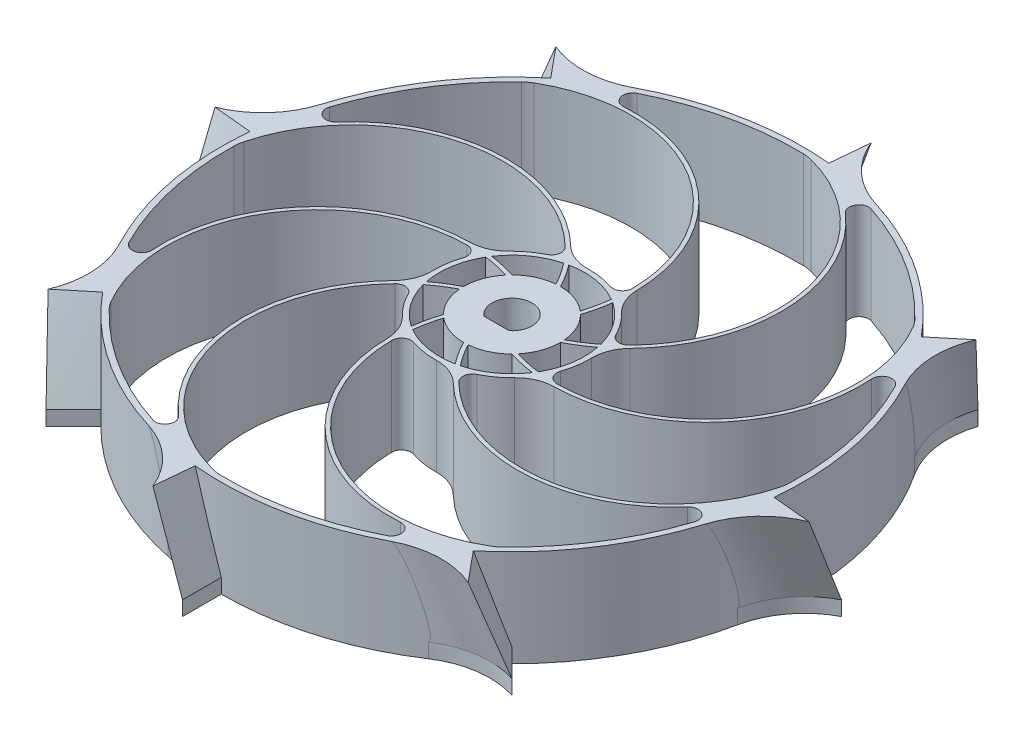
from build123d import *

# Parameters (mm, degrees)
SKETCH1_R             = 60
SKETCH1_R_2           = 58.8
BOSS_EXTRUDE1_DEPTH   = 20
SKETCH1_R_3           = 10
BOSS_EXTRUDE1_2_DEPTH = 20
BOSS_EXTRUDE4_DEPTH   = 20
CIRPATTERN1_COUNT     = 8
SKETCH2_R             = 16
SKETCH2_R_2           = 15
BOSS_EXTRUDE2_DEPTH   = 20
FILLET1_R             = 2
FILLET2_R             = 8
BOSS_EXTRUDE6_START   = -3
BOSS_EXTRUDE6_DEPTH   = 3
CIRPATTERN2_COUNT     = 8


with BuildPart() as part:
    # Sketch1 → Boss-Extrude1 (new body)
    with BuildSketch(Plane(origin=(0, 0, 0), x_dir=(1, 0, 0), z_dir=(0, 1, 0))):
        with Locations(Location((0, 0, 0), (0, 0, 270))):
            Circle(SKETCH1_R)
        with Locations(Location((0, 0, 0), (0, 0, 270))):
            Circle(SKETCH1_R_2, mode=Mode.SUBTRACT)
    extrude(amount=BOSS_EXTRUDE1_DEPTH)



with BuildPart() as body_2:
    # Sketch1 → Boss-Extrude1 2 (new body)
    with BuildSketch(Plane(origin=(0, 0, 0), x_dir=(1, 0, 0), z_dir=(0, 1, 0))):
        with Locations(Location((0, 0, 0), (0, 0, 270))):
            Circle(SKETCH1_R_3)
        with BuildLine():
            ThreePointArc((2.603003073, -3.2), (0, 4.125), (-2.603003073, -3.2))
            Line((-2.603003073, -3.2), (2.603003073, -3.2))
        make_face(mode=Mode.SUBTRACT)
    extrude(amount=BOSS_EXTRUDE1_2_DEPTH)


with BuildPart() as part_1:
    add(part.part)

    add(body_2.part)  # Boss-Extrude4 merges body 2
    # Sketch4 → Boss-Extrude4 (add)
    with BuildSketch(Plane(origin=(0, 0, 0), x_dir=(1, 0, 0), z_dir=(0, 1, 0))):
        with BuildLine():
            Line((-9.632475442, -0.71058124), (-10, 0))
            ThreePointArc((-10, 0), (-26.841730813, -33.640288469), (0, -60))
            Line((0, -60), (0.117199585, -59.208631402))
            ThreePointArc((0.117199585, -59.208631402), (-26.052615674, -33.508769279), (-9.632475442, -0.71058124))
        make_face()
    boss_extrude4 = extrude(amount=BOSS_EXTRUDE4_DEPTH)

    # CirPattern1: Boss-Extrude4 ×8 about axis
    cirpattern1_axis = Axis((0, 0, 0), (0, 1, 0))
    for i in range(1, CIRPATTERN1_COUNT):
        add(boss_extrude4.rotate(cirpattern1_axis, i * 360 / CIRPATTERN1_COUNT))

    # Sketch2 → Boss-Extrude2 (add)
    with BuildSketch(Plane(origin=(0, 0, 0), x_dir=(1, 0, 0), z_dir=(0, 1, 0))):
        Circle(SKETCH2_R)
        Circle(SKETCH2_R_2, mode=Mode.SUBTRACT)
    extrude(amount=BOSS_EXTRUDE2_DEPTH)

    # Fillet1
    fillet1_edges = [part_1.edges().sort_by_distance(p)[0] for p in [
        (-37.075909324, 10, -45.637889388),
        (-6.054234164, 10, 58.487487967),
        (6.054234164, 10, -58.487487967),
        (45.637889388, 10, -37.075909324),
        (58.487487967, 10, 6.054234164),
        (37.075909324, 10, 45.637889388),
        (-15.348469246, 10, 4.519346393),
        (-14.048667165, 10, -7.657346203),
        (-4.519346393, 10, -15.348469246),
        (7.657346203, 10, -14.048667165),
        (15.348469246, 10, -4.519346393),
        (14.048667165, 10, 7.657346203),
        (4.519346393, 10, 15.348469246),
        (-7.657346203, 10, 14.048667165),
        (-45.637889388, 10, 37.075909324),
        (-58.487487967, 10, -6.054234164),
    ]]
    fillet(fillet1_edges, radius=FILLET1_R)

    # Fillet2
    fillet2_edges = [part_1.edges().sort_by_distance(p)[0] for p in [
        (-39.929375219, 10, -43.163468287),
        (2.286849139, 10, -58.755513112),
        (-2.286849139, 10, 58.755513112),
        (43.163468287, 10, -39.929375219),
        (58.755513112, 10, 2.286849139),
        (39.929375219, 10, 43.163468287),
        (-8.419463854, 10, 13.605610181),
        (-15.574079207, 10, 3.667159236),
        (-13.605610181, 10, -8.419463854),
        (-3.667159236, 10, -15.574079207),
        (8.419463854, 10, -13.605610181),
        (15.574079207, 10, -3.667159236),
        (13.605610181, 10, 8.419463854),
        (3.667159236, 10, 15.574079207),
        (-43.163468287, 10, 39.929375219),
        (-58.755513112, 10, -2.286849139),
    ]]
    fillet(fillet2_edges, radius=FILLET2_R)

    # Sketch3 → Loft1 section 0
    with BuildSketch(Plane(origin=(0, 3, 0), x_dir=(1, 0, 0), z_dir=(0, 1, 0))):
        with BuildLine():
            Line((0, -68), (0, -60))
            ThreePointArc((0, -60), (-6.139084092, -59.685104059), (-12.213729096, -58.74372155))
            ThreePointArc((-12.213729096, -58.74372155), (-5.063374474, -61.994967767), (0, -68))
        make_face()
    # Sketch5 → Loft1 section 1
    with BuildSketch(Plane(origin=(0, 20, 0), x_dir=(1, 0, 0), z_dir=(0, 1, 0))):
        with BuildLine():
            Line((-6.401853142, -67.697978377), (-5.648693949, -59.733510333))
            ThreePointArc((-5.648693949, -59.733510333), (-11.730865487, -58.842049547), (-17.689903627, -57.332951343))
            ThreePointArc((-17.689903627, -57.332951343), (-10.877395513, -61.242926583), (-6.401853142, -67.697978377))
        make_face()
    loft1 = loft()

    # Sketch3<82> → Boss-Extrude6 (add)
    with BuildSketch(Plane(origin=(0, 3, 0), x_dir=(1, 0, 0), z_dir=(0, 1, 0)).offset(BOSS_EXTRUDE6_START)):
        with BuildLine():
            Line((0, -68), (0, -60))
            ThreePointArc((0, -60), (-6.139084092, -59.685104059), (-12.213729096, -58.74372155))
            ThreePointArc((-12.213729096, -58.74372155), (-5.063374474, -61.994967767), (0, -68))
        make_face()
    boss_extrude6 = extrude(amount=BOSS_EXTRUDE6_DEPTH)

    # CirPattern2: Loft1, Boss-Extrude6 ×8 about axis
    cirpattern2_axis = Axis((0, 21, 0), (0, -1, 0))
    add([loft1.rotate(cirpattern2_axis, i * 360 / CIRPATTERN2_COUNT) for i in range(1, CIRPATTERN2_COUNT)])
    add([boss_extrude6.rotate(cirpattern2_axis, i * 360 / CIRPATTERN2_COUNT) for i in range(1, CIRPATTERN2_COUNT)])


solid = part_1.part
